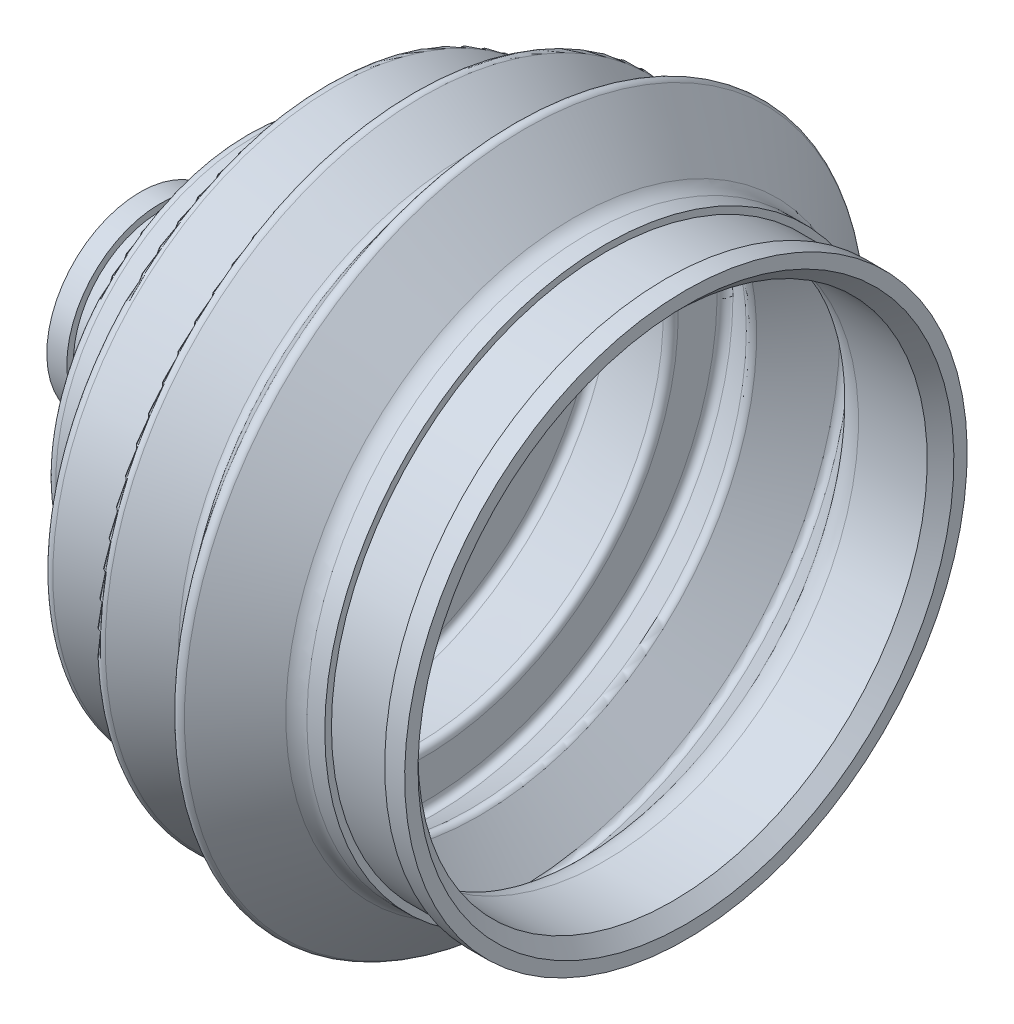
from build123d import *

# Parameters (mm, degrees)
SKETCH_3_W     = 17.5
SKETCH_3_H     = 3
SKETCH_3_W_2   = 16.656746848
CHAMFER_1_SIZE = 2
SKETCH_4_W     = 9
SKETCH_4_H     = 5
FILLET_1_R     = 1
FILLET_2_R     = 3
FILLET_3_R     = 5


with BuildPart() as part:
    # Эскиз1 → Revolve 1 (revolve)
    with BuildSketch(Plane.XY):
        Polygon((-82, 14), (-66, 14), (-66, 30.25), (-54, 27), (-54, 42.75), (-41, 39), (-41, 48.75), (-32, 43), (-25, 52), (-16, 42.25), (0, 42.25), (0, 40.75), (-16.656746848, 40.75), (-24.902172797, 49.682544779), (-31.655392716, 40.999833455), (-39.5, 46.011665886), (-39.5, 37.006147024), (-52.5, 40.756147024), (-52.5, 25.039710405), (-64.5, 28.289710405), (-64.5, 12.5), (-82, 12.5), align=None)
    revolve(axis=Axis((0, 0, 0), (-1, 0, 0)))

    # Эскиз3 → Revolve 1 2 (revolve)
    with BuildSketch(Plane.XY, mode=Mode.PRIVATE) as revolve_1_2_sk:
        with Locations((-73.25, 11.5)):
            Rectangle(SKETCH_3_W, SKETCH_3_H)
        with Locations((-8.328373424, 39.75)):
            Rectangle(SKETCH_3_W_2, SKETCH_3_H)
    revolve(revolve_1_2_sk.sketch.rotate(Axis((0, 0, 0), (-1, 0, 0)), 90), axis=Axis((0, 0, 0), (-1, 0, 0)))

    # Фаска1
    chamfer_1_edges = [part.edges().sort_by_distance(p)[0] for p in [
        (0, 0, 38.25),
    ]]
    chamfer(chamfer_1_edges, length=CHAMFER_1_SIZE)

    # Эскиз4 → Вырез-Повернуть1 (revolve, cut)
    with BuildSketch(Plane.XY):
        with Locations((-74.5, 15.5)):
            Rectangle(SKETCH_4_W, SKETCH_4_H)
        with Locations((-7.5, 43.75)):
            Rectangle(SKETCH_4_W, SKETCH_4_H)
    revolve(axis=Axis((0, 0, 0), (-1, 0, 0)), mode=Mode.SUBTRACT)

    # Скругление1
    fillet_1_edges = [part.edges().sort_by_distance(p)[0] for p in [
        (-25, -52, 0),
        (-32, -43, 0),
        (-41, -48.75, 0),
        (-41, -39, 0),
        (-54, -42.75, 0),
        (-54, -27, 0),
        (-66, -30.25, 0),
        (-64.5, -28.289710405, 0),
        (-52.5, -25.039710405, 0),
        (-52.5, -40.756147024, 0),
        (-39.5, -37.006147024, 0),
        (-39.5, -46.011665886, 0),
        (-31.655392716, -40.999833455, 0),
        (-24.902172797, -49.682544779, 0),
    ]]
    fillet(fillet_1_edges, radius=FILLET_1_R)

    # Скругление2
    fillet_2_edges = [part.edges().sort_by_distance(p)[0] for p in [
        (-16, -42.25, 0),
        (-66, -14, 0),
    ]]
    fillet(fillet_2_edges, radius=FILLET_2_R)

    # Скругление3
    # the kernel refuses this fillet: 5 mm, written as the material it takes off along each edge
    with BuildSketch(Plane(origin=(-64.5, 0, 0), x_dir=(0, 0, -1), z_dir=(0, 1, 0))) as fillet_3_piece_1:
        with BuildLine():
            CenterArc((10 + FILLET_3_R, FILLET_3_R), FILLET_3_R, 180, 90)
            Line((10, FILLET_3_R), (10 - FILLET_3_R * 0.02, FILLET_3_R))
            Line((10 - FILLET_3_R * 0.02, FILLET_3_R), (10 - FILLET_3_R * 0.02, -FILLET_3_R * 0.02))
            Line((10 - FILLET_3_R * 0.02, -FILLET_3_R * 0.02), (10 + FILLET_3_R, -FILLET_3_R * 0.02))
            Line((10 + FILLET_3_R, -FILLET_3_R * 0.02), (10 + FILLET_3_R, 0))
        make_face()
    revolve(axis=Axis((-64.5, 0, 0), (-1, 0, 0)), mode=Mode.SUBTRACT)
    with BuildSketch(Plane(origin=(-16.656746848, 0, 0), x_dir=(0, 0, -1), z_dir=(0, 1, 0))) as fillet_3_piece_2:
        with BuildLine():
            CenterArc((43.25, -4.330127019), FILLET_3_R, 120, 60)
            Line((40.75, 0), (40.7, 0.08660254))
            ThreePointArc((40.7, 0.08660254), (39.5, 0.1), (38.25, 0.1))
            Line((38.25, 0.1), (38.15, 0))
            Line((38.15, 0), (38.15, -4.330127019))
            Line((38.15, -4.330127019), (38.25, -4.330127019))
        make_face()
    revolve(axis=Axis((-16.656746848, 0, 0), (-1, 0, 0)), mode=Mode.SUBTRACT)


solid = part.part
